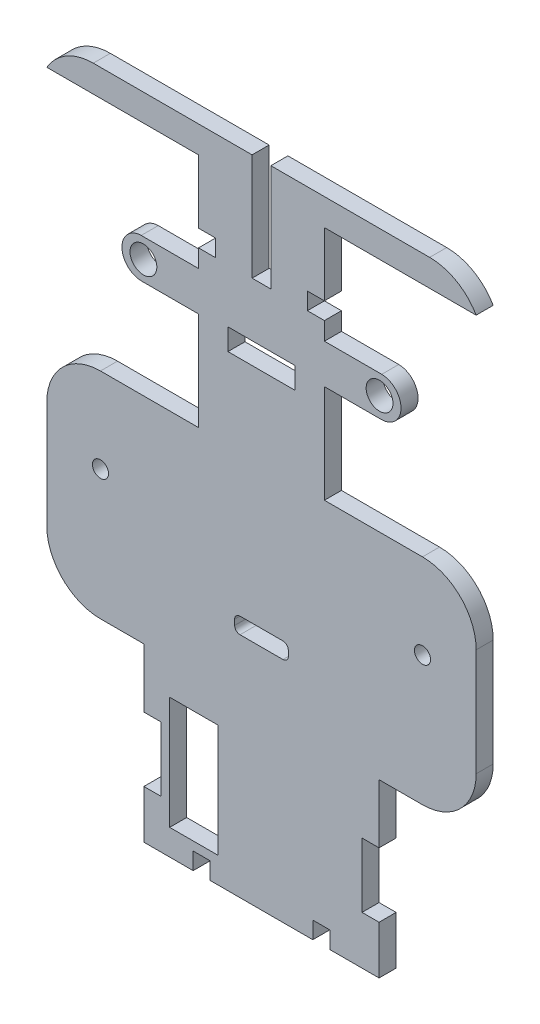
from build123d import *

# Parameters (mm, degrees)
SKETCH1_R           = 2.5
BOSS_EXTRUDE1_DEPTH = 3.175
FILLET1_R           = 10
SKETCH2_W           = 9
SKETCH2_H           = 21
CUT_EXTRUDE1_DEPTH  = 90.108082017
SKETCH3_W           = 12.5
SKETCH3_H           = 4
SKETCH3_W_2         = 3.5
SKETCH3_H_2         = 20
CUT_EXTRUDE2_DEPTH  = 90.108082017
FILLET2_R           = 10
SKETCH4_W           = 3.175
SKETCH4_H           = 3.175
BOSS_EXTRUDE2_DEPTH = 29
SKETCH5_W           = 3.175
SKETCH5_H           = 3.175
BOSS_EXTRUDE3_DEPTH = 29
SKETCH7_R           = 1.5
CUT_EXTRUDE3_DEPTH  = 10


with BuildPart() as part:
    # Sketch1 → Boss-Extrude1 (new body)
    with BuildSketch(Plane.XY):
        with BuildLine():
            Line((-9.56, -38.262636689), (-9.56, -41.437636689))
            Line((-9.56, -41.437636689), (9.56, -41.437636689))
            Line((9.56, -41.437636689), (9.56, -38.262636689))
            Line((9.56, -38.262636689), (12.735, -38.262636689))
            Line((12.735, -38.262636689), (12.735, -41.437636689))
            Line((12.735, -41.437636689), (15.91, -41.437636689))
            Line((15.91, -41.437636689), (21.91, -41.437636689))
            Line((21.91, -41.437636689), (21.91, -32.437636689))
            Line((21.91, -32.437636689), (18.735, -32.437636689))
            Line((18.735, -32.437636689), (18.735, -20.437636689))
            Line((18.735, -20.437636689), (21.91, -20.437636689))
            Line((21.91, -20.437636689), (21.91, -9.437636689))
            Line((21.91, -9.437636689), (40, -9.437636689))
            Line((40, -9.437636689), (40, 30.562363311))
            Line((40, 30.562363311), (10, 30.562363311))
            Line((10, 30.562363311), (10, 45.562363311))
            Line((10, 45.562363311), (10, 48.89577614))
            Line((10, 48.89577614), (22.410269523, 48.89577614))
            ThreePointArc((22.410269523, 48.89577614), (26.000000001, 52.562363311), (22.410269523, 56.228950483))
            Line((22.410269523, 56.228950483), (11.727794547, 56.228950483))
            Line((11.727794547, 56.228950483), (11.727794547, 59.562363311))
            Line((11.727794547, 59.562363311), (10, 59.562363311))
            Line((10, 59.562363311), (8.552794547, 59.562363311))
            Line((8.552794547, 59.562363311), (8.552794547, 62.737363311))
            Line((8.552794547, 62.737363311), (11.727794547, 62.737363311))
            Line((11.727794547, 62.737363311), (11.727794547, 74.562363311))
            Line((11.727794547, 74.562363311), (40, 74.562363311))
            Line((40, 74.562363311), (40, 79.562363311))
            Line((40, 79.562363311), (0, 79.562363311))
            Line((0, 79.562363311), (-40, 79.562363311))
            Line((-40, 79.562363311), (-40, 74.562363311))
            Line((-40, 74.562363311), (-11.727794547, 74.562363311))
            Line((-11.727794547, 74.562363311), (-11.727794547, 62.737363311))
            Line((-11.727794547, 62.737363311), (-8.552794547, 62.737363311))
            Line((-8.552794547, 62.737363311), (-8.552794547, 59.562363311))
            Line((-8.552794547, 59.562363311), (-10, 59.562363311))
            Line((-10, 59.562363311), (-11.727794547, 59.562363311))
            Line((-11.727794547, 59.562363311), (-11.727794547, 56.228950483))
            Line((-11.727794547, 56.228950483), (-22.410269523, 56.228950483))
            ThreePointArc((-22.410269523, 56.228950483), (-26.000000001, 52.562363311), (-22.410269523, 48.89577614))
            Line((-22.410269523, 48.89577614), (-10, 48.89577614))
            Line((-10, 48.89577614), (-10, 45.562363311))
            Line((-10, 45.562363311), (-10, 30.562363311))
            Line((-10, 30.562363311), (-40, 30.562363311))
            Line((-40, 30.562363311), (-40, -9.437636689))
            Line((-40, -9.437636689), (-21.91, -9.437636689))
            Line((-21.91, -9.437636689), (-21.91, -20.437636689))
            Line((-21.91, -20.437636689), (-18.735, -20.437636689))
            Line((-18.735, -20.437636689), (-18.735, -32.437636689))
            Line((-18.735, -32.437636689), (-21.91, -32.437636689))
            Line((-21.91, -32.437636689), (-21.91, -41.437636689))
            Line((-21.91, -41.437636689), (-15.91, -41.437636689))
            Line((-15.91, -41.437636689), (-12.735, -41.437636689))
            Line((-12.735, -41.437636689), (-12.735, -38.262636689))
            Line((-12.735, -38.262636689), (-9.56, -38.262636689))
        make_face()
        with BuildLine():
            Line((4, 1), (-4, 1))
            ThreePointArc((-4, 1), (-4.707106781, 1.292893219), (-5, 2))
            Line((-5, 2), (-5, 3))
            ThreePointArc((-5, 3), (-4.707106781, 3.707106781), (-4, 4))
            Line((-4, 4), (4, 4))
            ThreePointArc((4, 4), (4.707106781, 3.707106781), (5, 3))
            Line((5, 3), (5, 2))
            ThreePointArc((5, 2), (4.707106781, 1.292893219), (4, 1))
        make_face(mode=Mode.SUBTRACT)
        with Locations((-22, 52.562363311)):
            Circle(SKETCH1_R, mode=Mode.SUBTRACT)
        with Locations((22, 52.562363311)):
            Circle(SKETCH1_R, mode=Mode.SUBTRACT)
    extrude(amount=BOSS_EXTRUDE1_DEPTH)

    # Fillet1
    # the kernel refuses this fillet: 10 mm, written as the material it takes off along each edge
    with BuildSketch(Plane(origin=(-40, 79.562363311, -21.650635095), x_dir=(0, -1, 0), z_dir=(0, 0, 1))) as fillet1_piece_1:
        with BuildLine():
            CenterArc((10, 8.660254038), FILLET1_R, 180, 60)
            Line((0, 8.660254038), (-0.2, 8.660254038))
            Line((-0.2, 8.660254038), (-0.2, 0))
            Line((-0.2, 0), (0, -0.2))
            ThreePointArc((0, -0.2), (2.5, -0.2), (4.9, -0.173205081))
            Line((4.9, -0.173205081), (5, 0))
        make_face()
    extrude(amount=46.476270189, mode=Mode.SUBTRACT)
    with BuildSketch(Plane(origin=(40, 79.562363311, -21.650635095), x_dir=(-1, 0, 0), z_dir=(0, 0, 1))) as fillet1_piece_2:
        with BuildLine():
            CenterArc((8.660254038, 10), FILLET1_R, 210, 60)
            Line((0, 5), (-0.173205081, 4.9))
            ThreePointArc((-0.173205081, 4.9), (-0.2, 2.5), (-0.2, 0))
            Line((-0.2, 0), (0, -0.2))
            Line((0, -0.2), (8.660254038, -0.2))
            Line((8.660254038, -0.2), (8.660254038, 0))
        make_face()
    extrude(amount=46.476270189, mode=Mode.SUBTRACT)

    # Sketch2 → Cut-Extrude1 (cut, through all)
    with BuildSketch(Plane.XY.offset(3.175)):
        with Locations((-12.61, -26.137636689)):
            Rectangle(SKETCH2_W, SKETCH2_H)
    extrude(amount=-CUT_EXTRUDE1_DEPTH, mode=Mode.SUBTRACT)

    # Sketch3 → Cut-Extrude2 (cut, through all)
    with BuildSketch(Plane.XY.offset(3.175)):
        with Locations((0, 47.562363311)):
            Rectangle(SKETCH3_W, SKETCH3_H)
        with Locations((0, 69.663077344)):
            Rectangle(SKETCH3_W_2, SKETCH3_H_2)
    extrude(amount=-CUT_EXTRUDE2_DEPTH, mode=Mode.SUBTRACT)

    # Fillet2
    fillet2_edges = [part.edges().sort_by_distance(p)[0] for p in [
        (40, 30.562363311, 1.5875),
        (40, -9.437636689, 1.5875),
        (-40, -9.437636689, 1.5875),
        (-40, 30.562363311, 1.5875),
    ]]
    fillet(fillet2_edges, radius=FILLET2_R)

    # Sketch4 → Boss-Extrude2 (add)
    with BuildSketch(Plane(origin=(0, 59.562363311, 0), x_dir=(1, 0, 0), z_dir=(0, 1, 0))):
        with Locations((10.140294547, -1.5875)):
            Rectangle(SKETCH4_W, SKETCH4_H)
    extrude(amount=-BOSS_EXTRUDE2_DEPTH)

    # Sketch5 → Boss-Extrude3 (add)
    with BuildSketch(Plane(origin=(0, 59.562363311, 0), x_dir=(1, 0, 0), z_dir=(0, 1, 0))):
        with Locations((-10.140294547, -1.5875)):
            Rectangle(SKETCH5_W, SKETCH5_H)
    extrude(amount=-BOSS_EXTRUDE3_DEPTH)

    # Sketch7 → Cut-Extrude3 (cut)
    with BuildSketch(Plane.XY.offset(3.175)):
        with Locations((-30, 14.733489054)):
            Circle(SKETCH7_R)
        with Locations((30, 14.733489054)):
            Circle(SKETCH7_R)
    extrude(amount=-CUT_EXTRUDE3_DEPTH, mode=Mode.SUBTRACT)


solid = part.part
